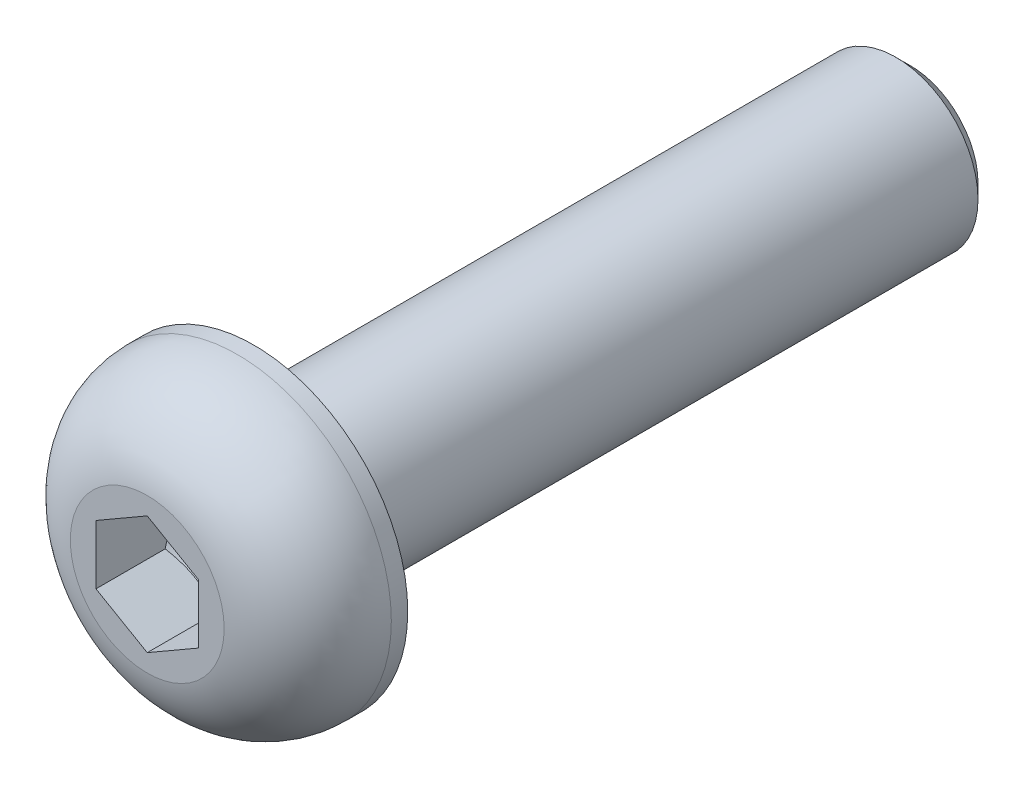
from build123d import *

# Parameters (mm, degrees)
CHAMFER1_SIZE      = 0.35
CUT_EXTRUDE1_START = -1.8000001
CUT_EXTRUDE1_DEPTH = 2.8000001
FILLET1_R          = 0.2


with BuildPart() as part:
    # Sketch1 → Revolve1 (revolve)
    with BuildSketch(Plane(origin=(0, 0, 0), x_dir=(0, 0, -1), z_dir=(1, 0, 0)), mode=Mode.PRIVATE) as revolve1_sk:
        with BuildLine():
            Line((16, 0), (16, 2))
            Line((16, 2), (0, 2))
            Line((0, 2), (0, 3.75))
            Line((0, 3.75), (-0.4, 3.75))
            ThreePointArc((-0.4, 3.75), (-1.845304899, 3.217657748), (-2.6, 1.875))
            Line((-2.6, 1.875), (-2.6, 0))
            Line((-2.6, 0), (16, 0))
        make_face()
    revolve(revolve1_sk.sketch.rotate(Axis((0, 0, 30.809969789), (0, 0, -1)), 90), axis=Axis((0, 0, 30.809969789), (0, 0, -1)))

    # Chamfer1
    chamfer1_edges = [part.edges().sort_by_distance(p)[0] for p in [
        (-2, 0, -16),
    ]]
    chamfer(chamfer1_edges, length=CHAMFER1_SIZE)

    # Sketch2 → Cut-Revolve1 (revolve, cut)
    with BuildSketch(Plane(origin=(0, 0, 0), x_dir=(0, 0, -1), z_dir=(1, 0, 0)), mode=Mode.PRIVATE) as cut_revolve1_sk:
        Polygon((-2.6, 0), (-2.6, 1.25), (-0.8, 1.25), (-0.078312164, 0), align=None)
    revolve(cut_revolve1_sk.sketch.rotate(Axis((0, 0, 2.452500839), (0, 0, -1)), 90), axis=Axis((0, 0, 2.452500839), (0, 0, -1)), mode=Mode.SUBTRACT)

    # Cut-Extrude1: read off the stored shape, not the designer's step
    # Cut-Extrude1 outline → Cut-Extrude1 (cut)
    with BuildSketch(Plane.XY.offset(2.6).offset(CUT_EXTRUDE1_START)):
        with BuildLine():
            Line((1.25, 0), (1.25, 0.721687836))
            Line((1.25, 0.721687836), (0.625, 1.082531755))
            ThreePointArc((0.625, 1.082531755), (1.082531755, 0.625), (1.25, 0))
        make_face()
        with BuildLine():
            ThreePointArc((-0.625, 1.082531755), (0, 1.25), (0.625, 1.082531755))
            Line((0.625, 1.082531755), (0, 1.443375673))
            Line((0, 1.443375673), (-0.625, 1.082531755))
        make_face()
        with BuildLine():
            Line((1.25, -0.721687836), (1.25, 0))
            ThreePointArc((1.25, 0), (1.082531755, -0.625), (0.625, -1.082531755))
            Line((0.625, -1.082531755), (1.25, -0.721687836))
        make_face()
        with BuildLine():
            ThreePointArc((-1.25, 0), (-1.082531755, 0.625), (-0.625, 1.082531755))
            Line((-0.625, 1.082531755), (-1.25, 0.721687836))
            Line((-1.25, 0.721687836), (-1.25, 0))
        make_face()
        with BuildLine():
            Line((0, -1.443375673), (0.625, -1.082531755))
            ThreePointArc((0.625, -1.082531755), (0, -1.25), (-0.625, -1.082531755))
            Line((-0.625, -1.082531755), (0, -1.443375673))
        make_face()
        with BuildLine():
            ThreePointArc((-0.625, -1.082531755), (-1.082531755, -0.625), (-1.25, 0))
            Line((-1.25, 0), (-1.25, -0.721687836))
            Line((-1.25, -0.721687836), (-0.625, -1.082531755))
        make_face()
    extrude(amount=CUT_EXTRUDE1_DEPTH, mode=Mode.SUBTRACT)

    # Cut-Extrude1 2 outline → Cut-Extrude1 2 (revolve)
    with BuildSketch(Plane.XZ):
        Polygon((1.443375738, 0.911645534), (1.249999957, 0.799999975), (1.443375673, 0.7999999), align=None)
    revolve(axis=Axis((0, 0, 0), (0, 0, 1)))

    # Fillet1
    fillet1_edges = [part.edges().sort_by_distance(p)[0] for p in [
        (-2, 0, 0),
    ]]
    fillet(fillet1_edges, radius=FILLET1_R)


solid = part.part
